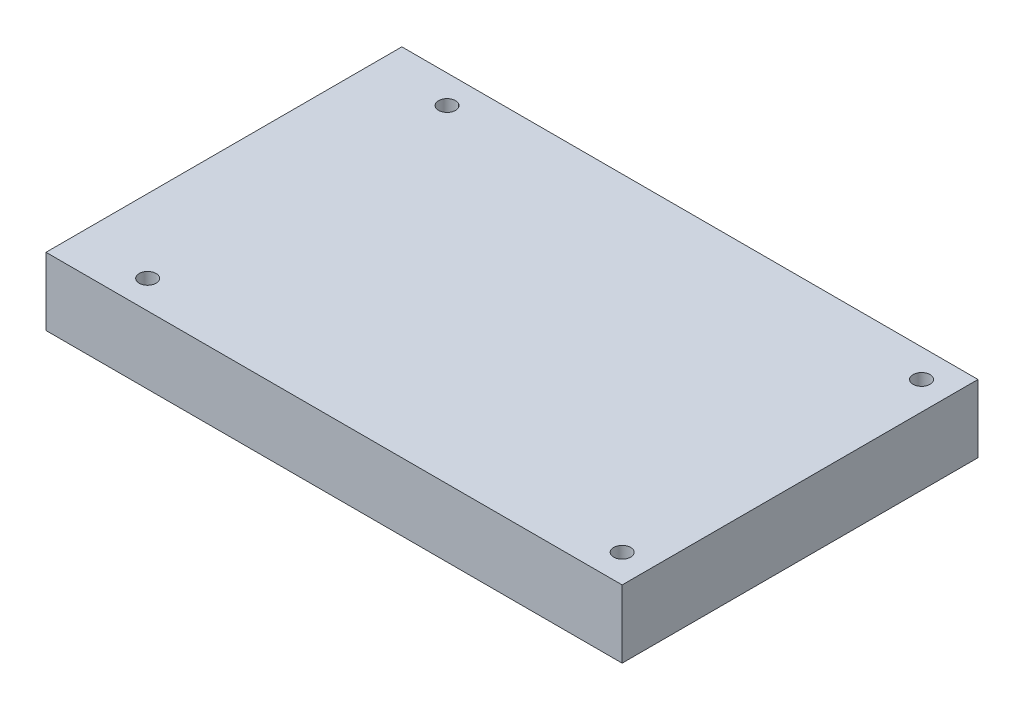
from build123d import *

# Parameters (mm, degrees)
SKETCH1_W           = 102
SKETCH1_H           = 63
BOSS_EXTRUDE1_DEPTH = 12
SKETCH2_R           = 1.5
CUT_EXTRUDE1_DEPTH  = 62.133051617


with BuildPart() as part:
    # Sketch1 → Boss-Extrude1 (new body)
    with BuildSketch(Plane(origin=(0, 0, 0), x_dir=(1, 0, 0), z_dir=(0, 1, 0))):
        Rectangle(SKETCH1_W, SKETCH1_H)
    extrude(amount=BOSS_EXTRUDE1_DEPTH)

    # Sketch2 → Cut-Extrude1 (cut, through all)
    with BuildSketch(Plane(origin=(0, 12, 0), x_dir=(1, 0, 0), z_dir=(0, 1, 0))):
        with Locations((-38, 26.5)):
            Circle(SKETCH2_R)
        with Locations((46, 26.5)):
            Circle(SKETCH2_R)
        with Locations((46, -26.5)):
            Circle(SKETCH2_R)
        with Locations((-38, -26.5)):
            Circle(SKETCH2_R)
    extrude(amount=-CUT_EXTRUDE1_DEPTH, mode=Mode.SUBTRACT)


solid = part.part
